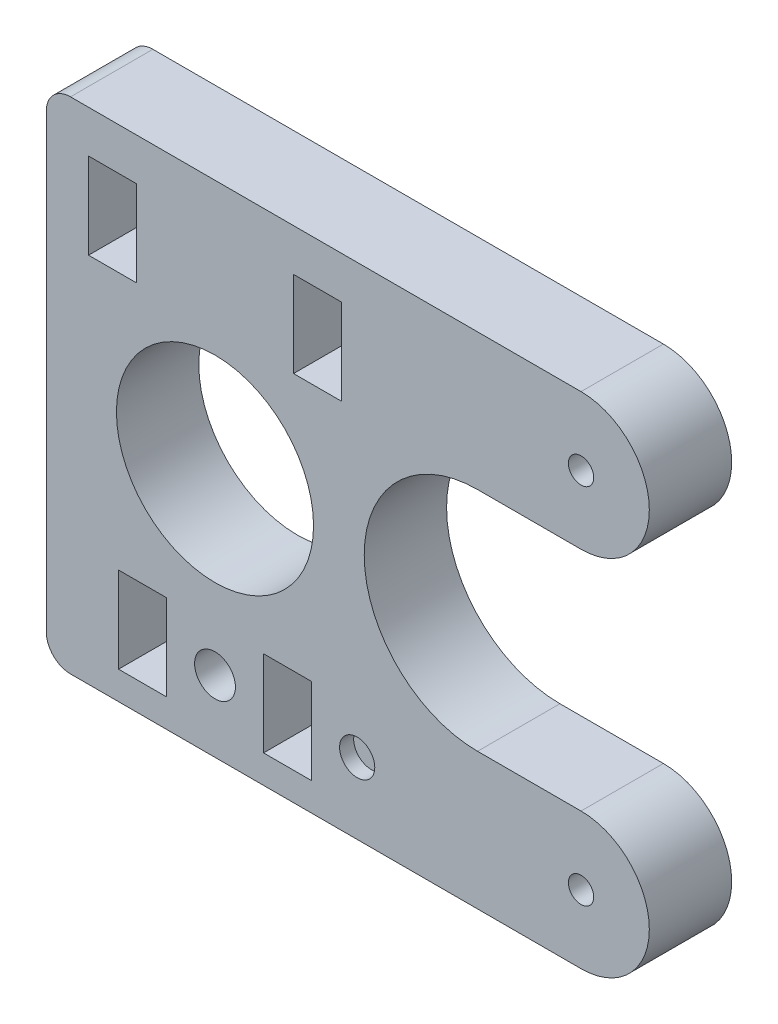
from build123d import *

# Parameters (mm, degrees)
SKETCH1_R           = 0.9
SKETCH1_R_2         = 1.45
SKETCH1_R_3         = 7
SKETCH1_W           = 3.400011
SKETCH1_H           = 6.1
SKETCH1_W_2         = 3.4
BOSS_EXTRUDE2_DEPTH = 5.85
SKETCH2_R           = 1.25
CUT_EXTRUDE1_DEPTH  = 1


with BuildPart() as part:
    # Sketch1 → Boss-Extrude2 (new body)
    with BuildSketch(Plane.XY):
        with BuildLine():
            Line((669.21684417, 348.51545661), (648.4638119, 348.51545661))
            ThreePointArc((648.4638119, 348.51545661), (647.249496344, 348.012470637), (646.746510371, 346.798155081))
            Line((646.746510371, 346.798155081), (646.746510371, 314.732758138))
            ThreePointArc((646.746510371, 314.732758138), (647.249496344, 313.518442582), (648.4638119, 313.01545661))
            Line((648.4638119, 313.01545661), (669.21684417, 313.01545661))
            Line((669.21684417, 313.01545661), (684.726521371, 313.01545661))
            ThreePointArc((684.726521371, 313.01545661), (689.576521371, 317.86545661), (684.726521371, 322.71545661))
            Line((684.726521371, 322.71545661), (677.376521371, 322.71545661))
            ThreePointArc((677.376521371, 322.71545661), (669.326521371, 330.76545661), (677.376521371, 338.81545661))
            Line((677.376521371, 338.81545661), (684.726521371, 338.81545661))
            ThreePointArc((684.726521371, 338.81545661), (689.576521371, 343.66545661), (684.726521371, 348.51545661))
            Line((684.726521371, 348.51545661), (669.21684417, 348.51545661))
        make_face()
        with Locations((684.726521371, 343.66545661)):
            Circle(SKETCH1_R, mode=Mode.SUBTRACT)
        with Locations((684.726521371, 317.86545661)):
            Circle(SKETCH1_R, mode=Mode.SUBTRACT)
        with Locations((658.726521371, 318.06545661)):
            Circle(SKETCH1_R_2, mode=Mode.SUBTRACT)
        with Locations((658.726521371, 330.76545661)):
            Circle(SKETCH1_R_3, mode=Mode.SUBTRACT)
        with Locations((651.446515871, 342.46545661)):
            Rectangle(SKETCH1_W, SKETCH1_H, mode=Mode.SUBTRACT)
        with Locations((653.576521371, 318.06545661)):
            Rectangle(SKETCH1_W_2, SKETCH1_H, mode=Mode.SUBTRACT)
        with Locations((666.006526871, 342.46545661)):
            Rectangle(SKETCH1_W, SKETCH1_H, mode=Mode.SUBTRACT)
        with Locations((663.876521371, 318.06545661)):
            Rectangle(SKETCH1_W_2, SKETCH1_H, mode=Mode.SUBTRACT)
    extrude(amount=BOSS_EXTRUDE2_DEPTH)

    # Sketch2 → Cut-Extrude1 (cut)
    with BuildSketch(Plane.XY.offset(5.85)):
        with Locations((668.826521371, 318.06545661)):
            Circle(SKETCH2_R)
    extrude(amount=-CUT_EXTRUDE1_DEPTH, mode=Mode.SUBTRACT)


solid = part.part
